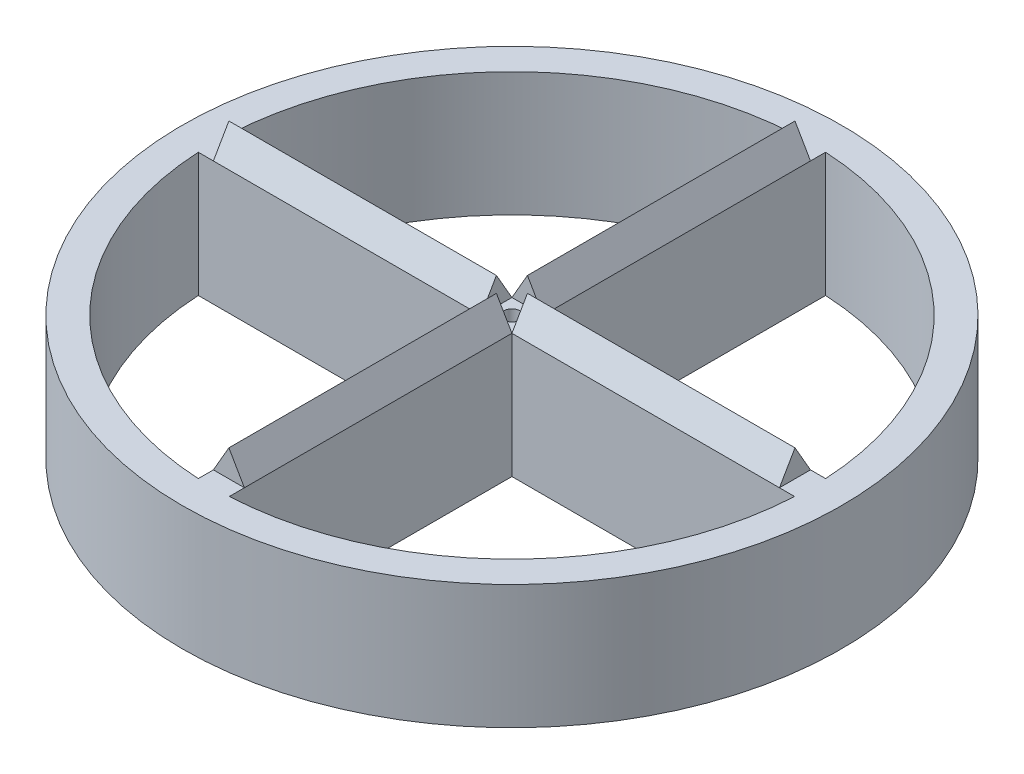
from build123d import *

# Parameters (mm, degrees)
SKETCH1_R                = 106.25
BOSS_EXTRUDE1_DEPTH      = 40
BOSS_EXTRUDE2_DEPTH      = 86.25
BOSS_EXTRUDE2_DEPTH_BACK = 96.25
CUT_EXTRUDE3_DEPTH       = 96.25
CUT_EXTRUDE3_DEPTH_BACK  = 96.25
SKETCH5_W                = 10
SKETCH5_H                = 17.660208907
BOSS_EXTRUDE3_DEPTH      = 86.25
BOSS_EXTRUDE3_DEPTH_BACK = 96.25
SKETCH7_W                = 10
SKETCH7_H                = 15.508918672
CUT_EXTRUDE4_DEPTH       = 10
SKETCH8_R                = 2.6
CUT_EXTRUDE5_DEPTH       = 110


with BuildPart() as part:
    # Sketch1 → Boss-Extrude1 (new body)
    with BuildSketch(Plane(origin=(0, 0, 0), x_dir=(1, 0, 0), z_dir=(0, 1, 0))):
        Circle(SKETCH1_R)
        with BuildLine():
            Line((-5, 5), (-5, 96.120042135))
            ThreePointArc((-5, 96.120042135), (-68.059027689, 68.059027689), (-96.120042135, 5))
            Line((-96.120042135, 5), (-5, 5))
        make_face(mode=Mode.SUBTRACT)
        with BuildLine():
            Line((5, 5), (5, 96.120042135))
            ThreePointArc((5, 96.120042135), (68.059027689, 68.059027689), (96.120042135, 5))
            Line((96.120042135, 5), (5, 5))
        make_face(mode=Mode.SUBTRACT)
        with BuildLine():
            Line((-5, -5), (-5, -96.120042135))
            ThreePointArc((-5, -96.120042135), (-68.059027689, -68.059027689), (-96.120042135, -5))
            Line((-96.120042135, -5), (-5, -5))
        make_face(mode=Mode.SUBTRACT)
        with BuildLine():
            Line((5, -5), (5, -96.120042135))
            ThreePointArc((5, -96.120042135), (68.059027689, -68.059027689), (96.120042135, -5))
            Line((96.120042135, -5), (5, -5))
        make_face(mode=Mode.SUBTRACT)
    extrude(amount=BOSS_EXTRUDE1_DEPTH)

    # Sketch2 → Boss-Extrude2 (add, two sides: drawn at the far end of the back side and taken through both)
    with BuildSketch(Plane.ZY.offset(5).offset(-BOSS_EXTRUDE2_DEPTH_BACK)):
        Polygon((-5, 40), (5, 40), (0, 48.660254038), align=None)
    extrude(amount=BOSS_EXTRUDE2_DEPTH + BOSS_EXTRUDE2_DEPTH_BACK)

    # Sketch5 → Cut-Extrude3 (cut, two sides: drawn at the far end of the back side and taken through both)
    with BuildSketch(Plane(origin=(0, 0, -5), x_dir=(-1, 0, 0), z_dir=(0, 0, -1)).offset(-CUT_EXTRUDE3_DEPTH_BACK)):
        with Locations((0, 48.830104453)):
            Rectangle(SKETCH5_W, SKETCH5_H)
    extrude(amount=CUT_EXTRUDE3_DEPTH + CUT_EXTRUDE3_DEPTH_BACK, mode=Mode.SUBTRACT)

    # Sketch6 → Boss-Extrude3 (add, two sides: drawn at the far end of the back side and taken through both)
    with BuildSketch(Plane(origin=(0, 0, -5), x_dir=(-1, 0, 0), z_dir=(0, 0, -1)).offset(-BOSS_EXTRUDE3_DEPTH_BACK)):
        Polygon((5, 40), (-5, 40), (0, 48.660254038), align=None)
    extrude(amount=BOSS_EXTRUDE3_DEPTH + BOSS_EXTRUDE3_DEPTH_BACK)

    # Sketch7 → Cut-Extrude4 (cut)
    with BuildSketch(Plane.ZY.offset(5)):
        with Locations((0, 47.754459336)):
            Rectangle(SKETCH7_W, SKETCH7_H)
    extrude(amount=-CUT_EXTRUDE4_DEPTH, mode=Mode.SUBTRACT)

    # Sketch8 → Cut-Extrude5 (cut)
    with BuildSketch(Plane(origin=(0, 40, 0), x_dir=(1, 0, 0), z_dir=(0, 1, 0))):
        Circle(SKETCH8_R)
    extrude(amount=-CUT_EXTRUDE5_DEPTH, mode=Mode.SUBTRACT)


solid = part.part
